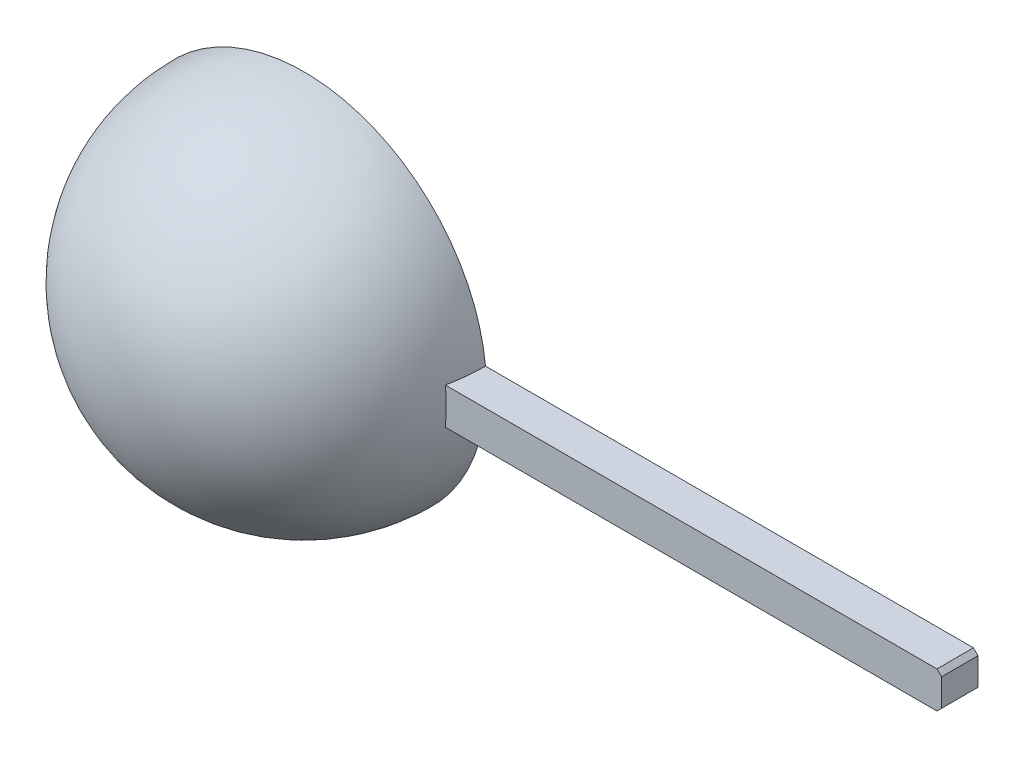
from build123d import *

# Parameters (mm, degrees)
R_VOLUTION1_ANGLE  = 180
COQUE1_T           = -2
ESQUISSE2_W        = 110
ESQUISSE2_H        = 8
BOSS_EXTRU_1_DEPTH = 8
CHANFREIN1_SIZE    = 1


with BuildPart() as part:
    # Esquisse1 → Révolution1 (revolve)
    with BuildSketch(Plane.XY):
        with BuildLine():
            Line((-40, 0), (40, 0))
            ThreePointArc((40, 0), (0, 40), (-40, 0))
        make_face()
    revolve(axis=Axis((-40, 0, 0), (1, 0, 0)), revolution_arc=R_VOLUTION1_ANGLE)

    # Coque1
    coque1_openings = [part.faces().sort_by_distance(p)[0] for p in [
        (0, 0, 0),
    ]]
    offset(amount=COQUE1_T, openings=coque1_openings)

    # Esquisse2 → Boss.-Extru.1 (add)
    with BuildSketch(Plane.XY):
        with Locations((92.788887255, 0)):
            Rectangle(ESQUISSE2_W, ESQUISSE2_H)
    extrude(amount=BOSS_EXTRU_1_DEPTH)

    # Chanfrein1
    chanfrein1_edges = [part.edges().sort_by_distance(p)[0] for p in [
        (147.788887255, 4, 4),
        (147.788887255, -4, 4),
    ]]
    chamfer(chanfrein1_edges, length=CHANFREIN1_SIZE)


solid = part.part
